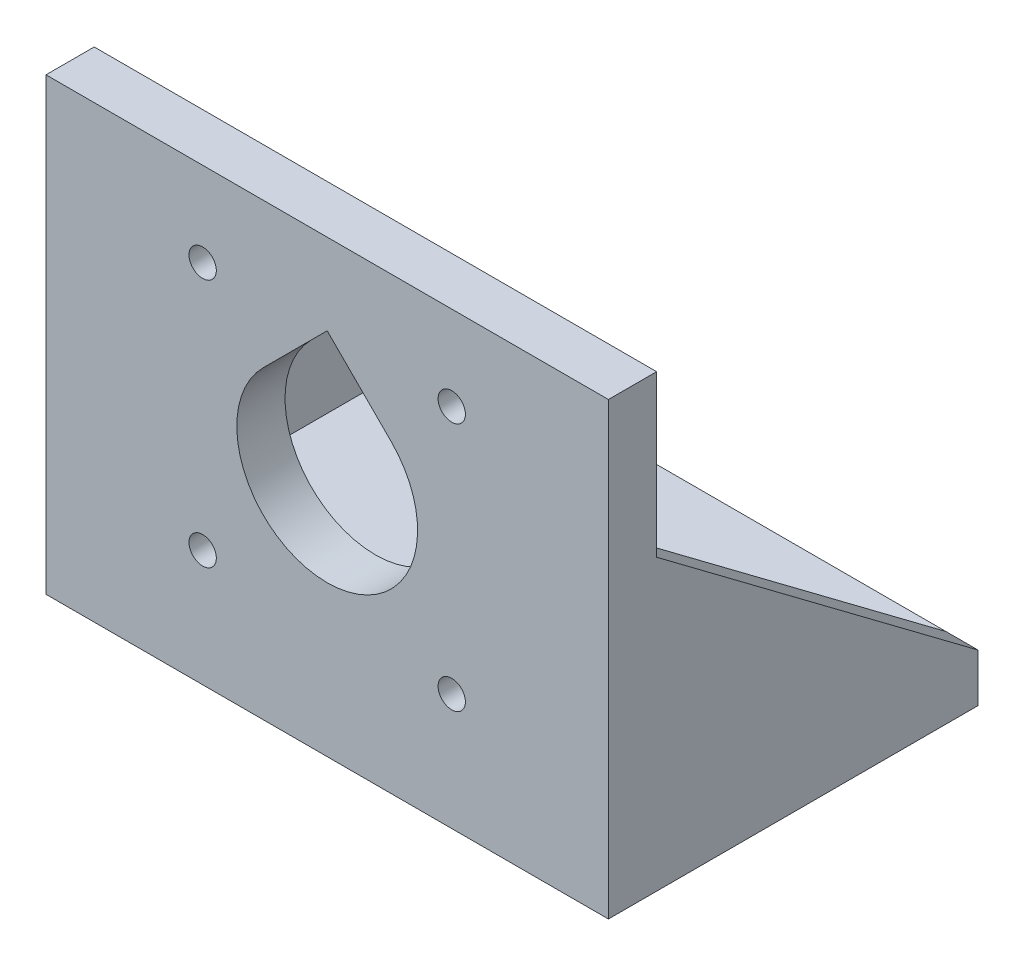
from build123d import *

# Parameters (mm, degrees)
SKETCH_01_W                   = 70
SKETCH_01_H                   = 56
EXTRUDE_01_DEPTH              = 6
SKETCH_02_W                   = 70
SKETCH_02_H                   = 46
EXTRUDE_02_DEPTH              = 6
EXTRUDE_03_DEPTH              = 4
EXTRUDE_START                 = 66
EXTRUDE_04_DEPTH              = 4
CUT_EXTRUDE_05_4_3_DEPTH      = 99.163129534
CUT_EXTRUDE_05_4_3_DEPTH_BACK = 99.163129534
SKETCH_05_R                   = 11.25
SKETCH_05_R_2                 = 1.7
CUT_EXTRUDE_06_DEPTH          = 99.163129534
CUT_EXTRUDE_06_DEPTH_BACK     = 99.163129534
CUT_EXTRUDE_07_4_4_DEPTH      = 99.163129534
CUT_EXTRUDE_07_4_4_DEPTH_BACK = 99.163129534
SKETCH_07_R                   = 2.25


with BuildPart() as part:
    # 01_Пластина_эскиз → 01_Передняя_пластина (new body)
    with BuildSketch(Plane.XY):
        with Locations((35, 28)):
            Rectangle(SKETCH_01_W, SKETCH_01_H)
    extrude(amount=EXTRUDE_01_DEPTH)

    # 02_Полка_эскиз → 02_Полка (add)
    with BuildSketch(Plane(origin=(0, 0, 0), x_dir=(1, 0, 0), z_dir=(0, 1, 0))):
        with Locations((35, 17)):
            Rectangle(SKETCH_02_W, SKETCH_02_H)
    extrude(amount=EXTRUDE_02_DEPTH)

    # 03_Косынка_левая_эскиз → 03_Косынка_левая (add)
    with BuildSketch(Plane(origin=(0, 0, 0), x_dir=(0, 0, -1), z_dir=(1, 0, 0))):
        Polygon((40, 6), (0, 6), (0, 36), align=None)
    extrude(amount=EXTRUDE_03_DEPTH)

    # 04_Косынка_правая_эскиз → 04_Косынка_правая (add)
    with BuildSketch(Plane(origin=(0, 0, 0), x_dir=(0, 0, -1), z_dir=(1, 0, 0)).offset(EXTRUDE_START)):
        Polygon((40, 6), (0, 6), (0, 36), align=None)
    extrude(amount=EXTRUDE_04_DEPTH)

    # 05_Мотор_передний_фланец_эскиз → 05_Буртик_и_4_отверстия_М3 (cut, two sides: drawn at the far end of the back side and taken through both)
    with BuildSketch(Plane.XY.offset(-CUT_EXTRUDE_05_4_3_DEPTH_BACK)):
        with Locations((35, 30)):
            Circle(SKETCH_05_R)
        with Locations((19.5, 14.5)):
            Circle(SKETCH_05_R_2)
        with Locations((19.5, 45.5)):
            Circle(SKETCH_05_R_2)
        with Locations((50.5, 14.5)):
            Circle(SKETCH_05_R_2)
        with Locations((50.5, 45.5)):
            Circle(SKETCH_05_R_2)
    extrude(amount=CUT_EXTRUDE_05_4_3_DEPTH + CUT_EXTRUDE_05_4_3_DEPTH_BACK, mode=Mode.SUBTRACT)

    # 06_Свод_45град_эскиз → 06_Свод_отверстия_для_печати (cut, two sides: drawn at the far end of the back side and taken through both)
    with BuildSketch(Plane.XY.offset(-CUT_EXTRUDE_06_DEPTH_BACK)):
        Polygon((27.045048712, 37.954951288), (42.954951288, 37.954951288), (35, 45.909902577), align=None)
    extrude(amount=CUT_EXTRUDE_06_DEPTH + CUT_EXTRUDE_06_DEPTH_BACK, mode=Mode.SUBTRACT)

    # 07_Крепление_полки_эскиз → 07_4_отверстия_М4 (cut, two sides: drawn at the far end of the back side and taken through both)
    with BuildSketch(Plane(origin=(0, 0, 0), x_dir=(1, 0, 0), z_dir=(0, 1, 0)).offset(-CUT_EXTRUDE_07_4_4_DEPTH_BACK)):
        with Locations((8.5, 12)):
            Circle(SKETCH_07_R)
        with Locations((8.5, 30)):
            Circle(SKETCH_07_R)
        with Locations((61.5, 12)):
            Circle(SKETCH_07_R)
        with Locations((61.5, 30)):
            Circle(SKETCH_07_R)
    extrude(amount=CUT_EXTRUDE_07_4_4_DEPTH + CUT_EXTRUDE_07_4_4_DEPTH_BACK, mode=Mode.SUBTRACT)


solid = part.part
